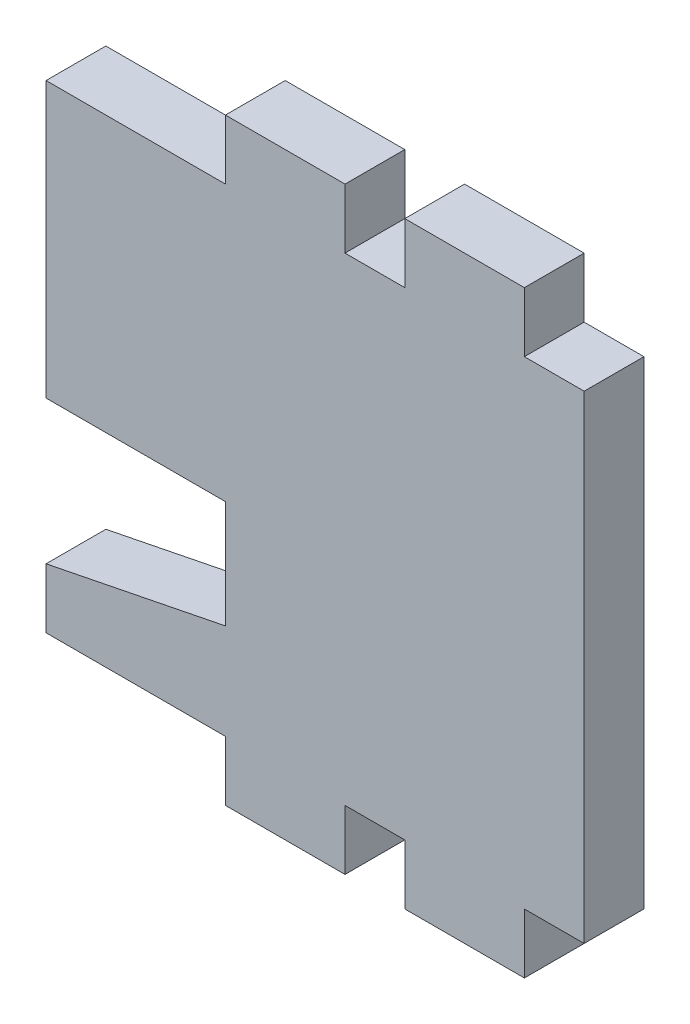
from build123d import *

# Parameters (mm, degrees)
BOSS_EXTRU_1_DEPTH = 5
ESQUISSE2_W        = 15
ESQUISSE2_H        = 23
BOSS_EXTRU_2_DEPTH = 5


with BuildPart() as part:
    # Esquisse1 → Boss.-Extru.1 (new body)
    with BuildSketch(Plane.XY):
        Polygon((10, 0), (15, 0), (15, -5), (25, -5), (25, 0), (30, 0), (30, 40), (25, 40), (25, 45), (15, 45), (15, 40), (10, 40), (10, 45), (0, 45), (0, 40), (0, 0), (0, -5), (10, -5), align=None)
    extrude(amount=BOSS_EXTRU_1_DEPTH)

    # Esquisse2 → Boss.-Extru.2 (add)
    with BuildSketch(Plane.XY.offset(5)):
        with Locations((-7.5, 28.5)):
            Rectangle(ESQUISSE2_W, ESQUISSE2_H)
        Polygon((-15, 0), (0, 0), (0, 8), (-15, 5), align=None)
    extrude(amount=-BOSS_EXTRU_2_DEPTH)


solid = part.part
